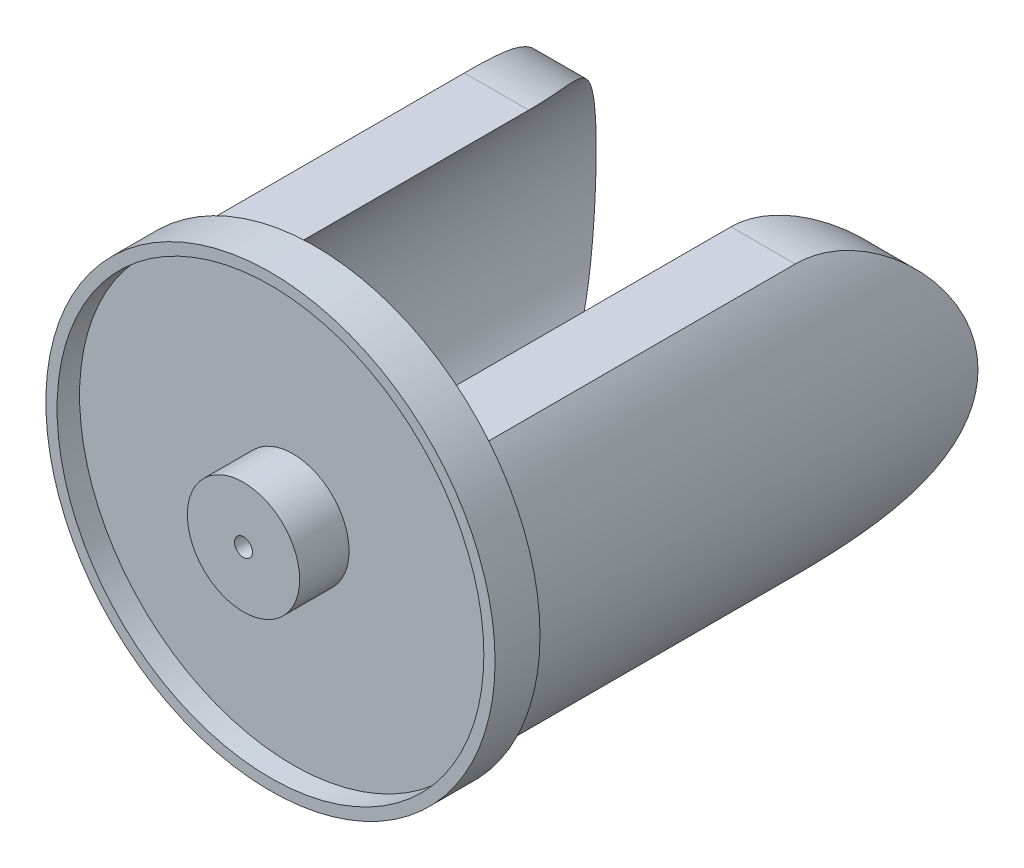
from build123d import *

# Parameters (mm, degrees)
ESQUISSE1_R             = 50
BOSS_EXTRU_1_DEPTH      = 10
ESQUISSE2_R             = 47.5
ENL_V_MAT_EXTRU_1_DEPTH = 5
ESQUISSE3_R             = 2
ENL_V_MAT_EXTRU_2_DEPTH = 5
BOSS_EXTRU_2_DEPTH      = 100
CONG_1_R                = 30
ESQUISSE5_R             = 12.5
BOSS_EXTRU_3_DEPTH      = 11
ENL_V_START             = -11
ESQUISSE6_R             = 2
ENL_V_MAT_EXTRU_3_DEPTH = 11


with BuildPart() as part:
    # Esquisse1 → Boss.-Extru.1 (new body)
    with BuildSketch(Plane.XY):
        Circle(ESQUISSE1_R)
    extrude(amount=BOSS_EXTRU_1_DEPTH)

    # Esquisse2 → Enlèv. mat.-Extru.1 (cut)
    with BuildSketch(Plane.XY.offset(10)):
        Circle(ESQUISSE2_R)
    extrude(amount=-ENL_V_MAT_EXTRU_1_DEPTH, mode=Mode.SUBTRACT)

    # Esquisse3 → Enlèv. mat.-Extru.2 (cut)
    with BuildSketch(Plane(origin=(0, 0, 0), x_dir=(-1, 0, 0), z_dir=(0, 0, -1))):
        Circle(ESQUISSE3_R)
    extrude(amount=-ENL_V_MAT_EXTRU_2_DEPTH, mode=Mode.SUBTRACT)

    # Esquisse4 → Boss.-Extru.2 (add)
    with BuildSketch(Plane(origin=(0, 0, 0), x_dir=(-1, 0, 0), z_dir=(0, 0, -1))):
        with BuildLine():
            ThreePointArc((-22.5, -30), (-37.5, 0), (-22.5, 30))
            Line((-22.5, 30), (-36.827299657, 30))
            ThreePointArc((-36.827299657, 30), (-47.5, 0), (-36.827299657, -30))
            Line((-36.827299657, -30), (-22.5, -30))
        make_face()
        with BuildLine():
            Line((36.827299657, 30), (22.5, 30))
            ThreePointArc((22.5, 30), (33.541019662, 16.770509831), (37.5, 0))
            ThreePointArc((37.5, 0), (33.541019662, -16.770509831), (22.5, -30))
            Line((22.5, -30), (36.827299657, -30))
            ThreePointArc((36.827299657, -30), (44.752355992, -15.920949505), (47.5, 0))
            ThreePointArc((47.5, 0), (44.752355992, 15.920949505), (36.827299657, 30))
        make_face()
    extrude(amount=BOSS_EXTRU_2_DEPTH)

    # Congé1
    # the kernel refuses this fillet: 30 mm, written as the material it takes off along each edge
    with BuildSketch(Plane(origin=(111.827299657, -30, -100), x_dir=(0, 0, 1), z_dir=(-1, 0, 0)), Plane(origin=(-52.5, 30, -100), x_dir=(0, 0, 1), z_dir=(1, 0, 0)), Plane(origin=(52.5, -30, -100), x_dir=(0, 0, 1), z_dir=(-1, 0, 0)), Plane(origin=(-111.827299657, 30, -100), x_dir=(0, 0, 1), z_dir=(1, 0, 0))) as cong_1_piece_1:
        with BuildLine():
            CenterArc((CONG_1_R, CONG_1_R), CONG_1_R, 180, 90)
            Line((0, CONG_1_R), (0, 0))
            Line((0, 0), (CONG_1_R, 0))
        make_face()
    extrude(amount=164.327299657, mode=Mode.SUBTRACT)

    # Esquisse5 → Boss.-Extru.3 (add)
    with BuildSketch(Plane.XY.offset(5)):
        Circle(ESQUISSE5_R)
    extrude(amount=BOSS_EXTRU_3_DEPTH)

    # Esquisse6 → Enlèv. mat.-Extru.3 (cut)
    with BuildSketch(Plane.XY.offset(16).offset(ENL_V_START)):
        with Locations(Location((0, 0, 0), (0, 0, 180))):
            Circle(ESQUISSE6_R)
    extrude(amount=ENL_V_MAT_EXTRU_3_DEPTH, mode=Mode.SUBTRACT)


solid = part.part
